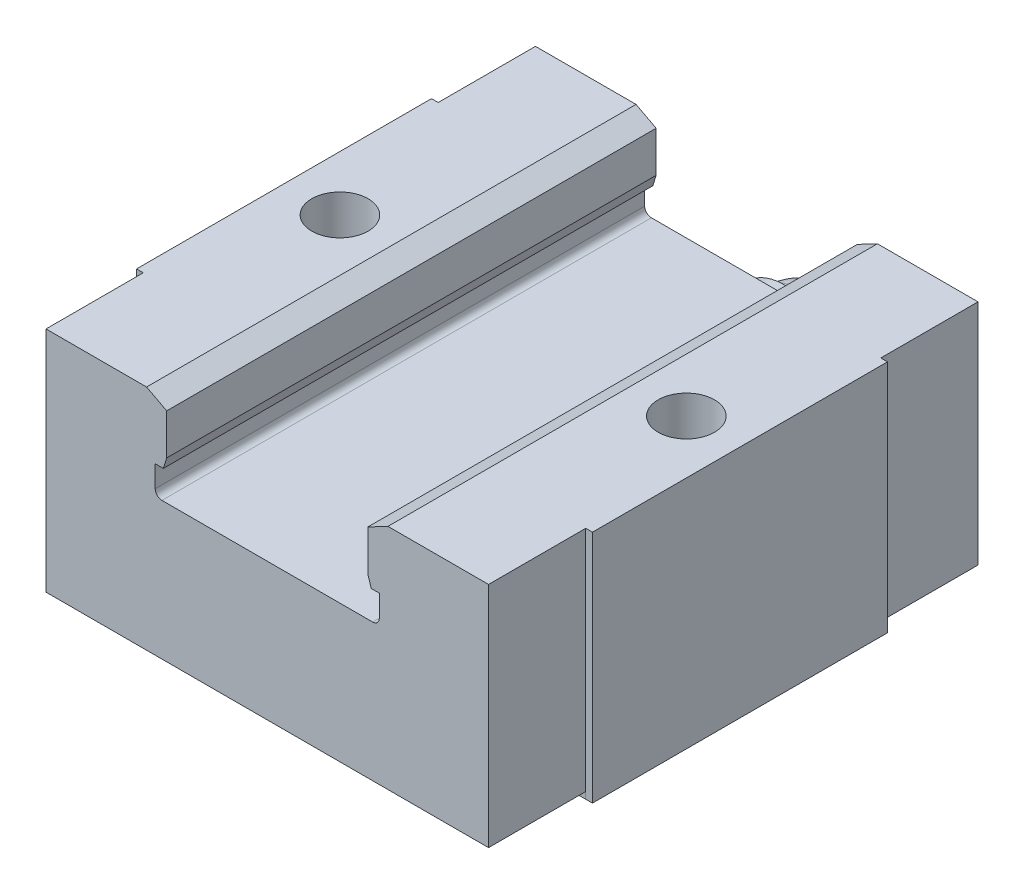
from build123d import *

# Parameters (mm, degrees)
BOSS_EXTRU_2_DEPTH         = 36.5
CONG_1_R                   = 0.5
ESQUISSE2_R                = 3.75
BOSS_EXTRU_3_DEPTH         = 2
ESQUISSE3_R                = 3
BOSS_EXTRU_4_DEPTH         = 1
ESQUISSE5_W                = 7.5
ESQUISSE5_H                = 37.315621328
ENL_V_MAT_EXTRU_2_DEPTH    = 5
ESQUISSE6_W                = 33
ESQUISSE6_H                = 22
BOSS_EXTRU_6_DEPTH         = 0.5
ESQUISSE7_W                = 22.000592026
ESQUISSE7_H                = 17.5
BOSS_EXTRU_7_DEPTH         = 0.5
ESQUISSE8_W                = 21.996306334
ESQUISSE8_H                = 17.5
BOSS_EXTRU_8_DEPTH         = 0.5
ESQUISSE9_W                = 5.5
ESQUISSE9_H                = 22
ENL_V_MAT_EXTRU_3_DEPTH    = 0.5
ESQUISSE10_R               = 2
ENL_V_MAT_EXTRU_4_DEPTH    = 10.5
ESQUISSE11_W               = 2.1
ESQUISSE11_H               = 7.00005
TROU_TARAUD_M51_AT_2_COUNT = 2
TROU_TARAUD_M51_AT_2_PITCH = 25.902595086


# Read off the part's stored shape, not the designer's step: Dôme1
with BuildPart() as part:
    # Esquisse1 → Boss.-Extru.2 (new body)
    with BuildSketch(Plane.XY):
        Polygon((-16.5, 0), (-16.5, 10.25), (-22.270485302, 10.25), (-24.856553081, 10.25), (-24.856553081, 12.366468473), (-24.25, 12.366468473), (-23.5, 14.775104227), (-23.5, 15.186461692), (-23, 15.684420728), (-25.5, 17), (-33, 17), (-33, 0), align=None)
        Polygon((-10.729514698, 10.25), (-16.5, 10.25), (-16.5, 0), (0, 0), (0, 17), (-7.5, 17), (-10, 15.684420728), (-9.5, 15.186461692), (-9.5, 14.775104227), (-8.75, 12.366468473), (-8.143446919, 12.366468473), (-8.143446919, 10.25), align=None)
    extrude(amount=BOSS_EXTRU_2_DEPTH)

    # Congé1
    cong_1_edges = [part.edges().sort_by_distance(p)[0] for p in [
        (-23.5, 15.186461692, 18.25),
        (-24.856553081, 10.25, 18.25),
        (-8.143446919, 10.25, 18.25),
        (-9.5, 15.186461692, 18.25),
    ]]
    fillet(cong_1_edges, radius=CONG_1_R)

    # Esquisse2 → Boss.-Extru.3 (add)
    with BuildSketch(Plane(origin=(0, 0, 0), x_dir=(-1, 0, 0), z_dir=(0, 0, -1))):
        with Locations(Location((16.5, 5.125, 0), (0, 0, 180))):
            Circle(ESQUISSE2_R)
    extrude(amount=BOSS_EXTRU_3_DEPTH)

    # Esquisse3 → Boss.-Extru.4 (add)
    with BuildSketch(Plane(origin=(0, 0, -2), x_dir=(-1, 0, 0), z_dir=(0, 0, -1))):
        with Locations((16.5, 5.125)):
            Circle(ESQUISSE3_R)
    extrude(amount=BOSS_EXTRU_4_DEPTH)

    # Dôme1 outline → Dôme1 (revolve)
    with BuildSketch(Plane(origin=(-16.5, 5.125, 0), x_dir=(1, 0, 0), z_dir=(0, -1, 0))):
        with BuildLine():
            Line((0, -2.999999997), (0, -6))
            ThreePointArc((0, -6), (2.121320345, -5.121320342), (3, -2.999999997))
            Line((3, -2.999999997), (0, -2.999999997))
        make_face()
    revolve(axis=Axis((-16.5, 5.125, 0), (0, 0, 1)))

    # Esquisse5 → Enlèv. mat.-Extru.2 (cut)
    with BuildSketch(Plane(origin=(0, 17, 0), x_dir=(1, 0, 0), z_dir=(0, 1, 0))):
        with Locations((-12.75, -18.657810664)):
            Rectangle(ESQUISSE5_W, ESQUISSE5_H)
        with Locations((-20.25, -18.657810664)):
            Rectangle(ESQUISSE5_W, ESQUISSE5_H)
    extrude(amount=-ENL_V_MAT_EXTRU_2_DEPTH, mode=Mode.SUBTRACT)

    # Esquisse6 → Boss.-Extru.6 (add)
    with BuildSketch(Plane(origin=(0, 0, 0), x_dir=(-1, 0, 0), z_dir=(0, -1, 0))):
        with Locations((16.5, -18.25)):
            Rectangle(ESQUISSE6_W, ESQUISSE6_H)
    extrude(amount=BOSS_EXTRU_6_DEPTH)

    # Esquisse7 → Boss.-Extru.7 (add)
    with BuildSketch(Plane(origin=(0, 0, 0), x_dir=(0, 0, -1), z_dir=(1, 0, 0))):
        with Locations((-18.250296013, 8.25)):
            Rectangle(ESQUISSE7_W, ESQUISSE7_H)
    extrude(amount=BOSS_EXTRU_7_DEPTH)

    # Esquisse8 → Boss.-Extru.8 (add)
    with BuildSketch(Plane.ZY.offset(33)):
        with Locations((18.251846833, 8.25)):
            Rectangle(ESQUISSE8_W, ESQUISSE8_H)
    extrude(amount=BOSS_EXTRU_8_DEPTH)

    # Esquisse9 → Enlèv. mat.-Extru.3 (cut)
    with BuildSketch(Plane(origin=(0, -0.5, 0), x_dir=(-1, 0, 0), z_dir=(0, -1, 0))):
        with Locations((14, -18.25)):
            Rectangle(ESQUISSE9_W, ESQUISSE9_H)
        with Locations((19.5, -18.25)):
            Rectangle(ESQUISSE9_W, ESQUISSE9_H)
    extrude(amount=-ENL_V_MAT_EXTRU_3_DEPTH, mode=Mode.SUBTRACT)

    # Esquisse10 → Enlèv. mat.-Extru.4 (cut)
    with BuildSketch(Plane.XZ.offset(0.5)):
        with Locations(Location((-3.5, 18.250296013, 0), (0, 0, 270))):
            Circle(ESQUISSE10_R)
        with Locations(Location((-29.5, 18.250296013, 0), (0, 0, 270))):
            Circle(ESQUISSE10_R)
    extrude(amount=-ENL_V_MAT_EXTRU_4_DEPTH, mode=Mode.SUBTRACT)

    # Esquisse11 → Trou taraudé M51 (revolve, cut)
    with BuildSketch(Plane(origin=(-29.402494858, 10, 18.178238283), x_dir=(0, 0, -1), z_dir=(1, 0, 0))):
        with Locations((1.05, 3.500025)):
            Rectangle(ESQUISSE11_W, ESQUISSE11_H)
    trou_taraud_m51 = revolve(axis=Axis((-29.402494858, 3.65, 18.178238283), (0, 1, 0)), mode=Mode.SUBTRACT)

    # Trou taraudé M51 at 2: Trou taraudé M51 ×2
    with Locations(*[Vector(0.9999961305838194, 0, 0.002781873000113731) * (i * TROU_TARAUD_M51_AT_2_PITCH) for i in range(1, TROU_TARAUD_M51_AT_2_COUNT)]):
        add(trou_taraud_m51, mode=Mode.SUBTRACT)


solid = part.part
